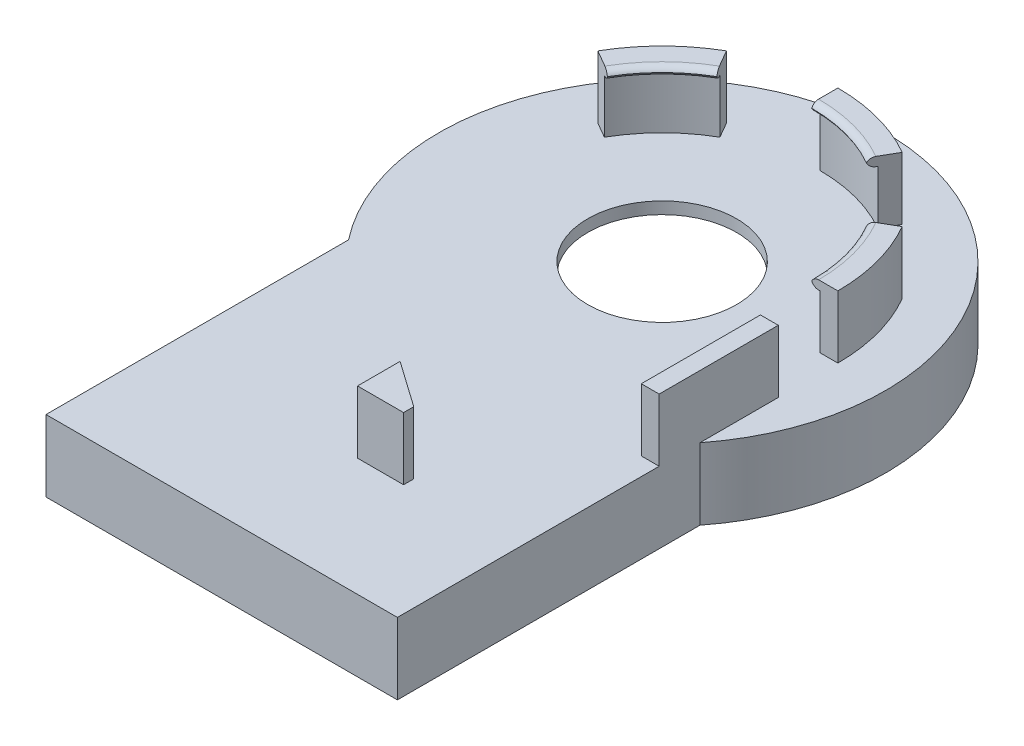
from build123d import *

# Parameters (mm, degrees)
SKETCH1_R           = 37.5
SKETCH1_R_2         = 35.5
BOSS_EXTRUDE1_DEPTH = 10
SKETCH2_R           = 37.5
SKETCH2_R_2         = 12.5
BOSS_EXTRUDE2_DEPTH = 2
BOSS_EXTRUDE3_DEPTH = 9
BOSS_EXTRUDE4_DEPTH = 1.5
FILLET1_R           = 1.27
SKETCH6_W           = 3
SKETCH6_H           = 10.5
BOSS_EXTRUDE5_DEPTH = 30
SKETCH7_W           = 3
SKETCH7_H           = 10
CUT_EXTRUDE1_DEPTH  = 10.5
BOSS_EXTRUDE6_DEPTH = 10.5
BOSS_EXTRUDE8_START = -12
BOSS_EXTRUDE8_DEPTH = 12


with BuildPart() as part:
    # Sketch1 → Boss-Extrude1 (new body)
    with BuildSketch(Plane(origin=(0, 0, 0), x_dir=(1, 0, 0), z_dir=(0, 1, 0))):
        with Locations(Location((0, 0, 0), (0, 0, 270))):
            Circle(SKETCH1_R)
        with Locations(Location((0, 0, 0), (0, 0, 270))):
            Circle(SKETCH1_R_2, mode=Mode.SUBTRACT)
    extrude(amount=BOSS_EXTRUDE1_DEPTH)

    # Sketch2 → Boss-Extrude2 (add)
    with BuildSketch(Plane(origin=(0, 10, 0), x_dir=(1, 0, 0), z_dir=(0, 1, 0))):
        with Locations(Location((0, 0, 0), (0, 0, 270))):
            Circle(SKETCH2_R)
        with Locations(Location((0, 0, 0), (0, 0, 270))):
            Circle(SKETCH2_R_2, mode=Mode.SUBTRACT)
    extrude(amount=BOSS_EXTRUDE2_DEPTH)

    # Sketch4 → Boss-Extrude3 (add)
    with BuildSketch(Plane(origin=(0, 12, 0), x_dir=(1, 0, 0), z_dir=(0, 1, 0))):
        with BuildLine():
            Line((13.25, 22.9496732), (14.75, 25.547749412))
            ThreePointArc((14.75, 25.547749412), (7.635161831, 28.494811876), (0, 29.5))
            Line((0, 29.5), (0, 26.5))
            ThreePointArc((0, 26.5), (6.858704695, 25.597034397), (13.25, 22.9496732))
        make_face()
        with BuildLine():
            ThreePointArc((26.5, 0), (25.597034397, 6.858704695), (22.9496732, 13.25))
            Line((22.9496732, 13.25), (25.547749412, 14.75))
            ThreePointArc((25.547749412, 14.75), (28.494811876, 7.635161831), (29.5, 0))
            Line((29.5, 0), (26.5, 0))
        make_face()
        with BuildLine():
            Line((-13.25, 22.9496732), (-14.75, 25.547749412))
            ThreePointArc((-14.75, 25.547749412), (-20.859650045, 20.859650045), (-25.547749412, 14.75))
            Line((-25.547749412, 14.75), (-22.9496732, 13.25))
            ThreePointArc((-22.9496732, 13.25), (-18.738329701, 18.738329701), (-13.25, 22.9496732))
        make_face()
    extrude(amount=BOSS_EXTRUDE3_DEPTH)

    # Sketch5 → Boss-Extrude4 (add)
    with BuildSketch(Plane(origin=(0, 21, 0), x_dir=(1, 0, 0), z_dir=(0, 1, 0))):
        with BuildLine():
            Line((-12.5, 21.650635095), (-14.75, 25.547749412))
            ThreePointArc((-14.75, 25.547749412), (-20.859650045, 20.859650045), (-25.547749412, 14.75))
            Line((-25.547749412, 14.75), (-21.650635095, 12.5))
            ThreePointArc((-21.650635095, 12.5), (-17.67766953, 17.67766953), (-12.5, 21.650635095))
        make_face()
        with BuildLine():
            ThreePointArc((0, 26.5), (6.858704695, 25.597034397), (13.25, 22.9496732))
            Line((13.25, 22.9496732), (14.75, 25.547749412))
            ThreePointArc((14.75, 25.547749412), (7.635161831, 28.494811876), (0, 29.5))
            Line((0, 29.5), (0, 26.5))
        make_face()
        with BuildLine():
            Line((0, 26.5), (0, 25))
            ThreePointArc((0, 25), (6.470476128, 24.148145657), (12.5, 21.650635095))
            Line((12.5, 21.650635095), (13.25, 22.9496732))
            ThreePointArc((13.25, 22.9496732), (6.858704695, 25.597034397), (0, 26.5))
        make_face()
        with BuildLine():
            Line((25, 0), (29.5, 0))
            ThreePointArc((29.5, 0), (28.494811876, 7.635161831), (25.547749412, 14.75))
            Line((25.547749412, 14.75), (21.650635095, 12.5))
            ThreePointArc((21.650635095, 12.5), (24.148145657, 6.470476128), (25, 0))
        make_face()
    extrude(amount=BOSS_EXTRUDE4_DEPTH)

    # Fillet1
    # the kernel refuses this fillet: 1.27 mm, written as the material it takes off along each edge
    with BuildSketch(Plane(origin=(0, 21, 0), x_dir=(0.795717852622937, 0, -0.605667482218702), z_dir=(-0.605667482218702, 0, -0.795717852622937))) as fillet1_piece_1:
        with BuildLine():
            CenterArc((25 + FILLET1_R, -FILLET1_R), FILLET1_R, 90, 90)
            Line((25 + FILLET1_R, 0), (25, 0))
            Line((25, 0), (25, -FILLET1_R))
        make_face()
    revolve(axis=Axis((0, 21, 0), (0, -1, 0)), revolution_arc=44.553777402, mode=Mode.SUBTRACT)
    with BuildSketch(Plane(origin=(0, 22.5, 0), x_dir=(0.795717852622937, 0, -0.605667482218702), z_dir=(-0.605667482218702, 0, -0.795717852622937))) as fillet1_piece_2:
        with BuildLine():
            CenterArc((25 + FILLET1_R, FILLET1_R), FILLET1_R, 180, 90)
            Line((25, FILLET1_R), (25, 0))
            Line((25, 0), (25 + FILLET1_R, 0))
        make_face()
    revolve(axis=Axis((0, 22.5, 0), (0, -1, 0)), revolution_arc=44.553777402, mode=Mode.SUBTRACT)
    with BuildSketch(Plane(origin=(0, 21, 0), x_dir=(-0.12666449953608933, 0, -0.9919456157256162), z_dir=(-0.9919456157256162, 0, 0.12666449953608933))) as fillet1_piece_3:
        with BuildLine():
            CenterArc((25 + FILLET1_R, -FILLET1_R), FILLET1_R, 90, 90)
            Line((25 + FILLET1_R, 0), (25, 0))
            Line((25, 0), (25, -FILLET1_R))
        make_face()
    revolve(axis=Axis((0, 21, 0), (0, -1, 0)), revolution_arc=44.553777402, mode=Mode.SUBTRACT)
    with BuildSketch(Plane(origin=(0, 22.5, 0), x_dir=(-0.12666449953608933, 0, -0.9919456157256162), z_dir=(-0.9919456157256162, 0, 0.12666449953608933))) as fillet1_piece_4:
        with BuildLine():
            CenterArc((25 + FILLET1_R, FILLET1_R), FILLET1_R, 180, 90)
            Line((25, FILLET1_R), (25, 0))
            Line((25, 0), (25 + FILLET1_R, 0))
        make_face()
    revolve(axis=Axis((0, 22.5, 0), (0, -1, 0)), revolution_arc=44.553777402, mode=Mode.SUBTRACT)
    with BuildSketch(Plane(origin=(0, 21, 0), x_dir=(-0.9223823521590265, 0, -0.386278133506909), z_dir=(-0.386278133506909, 0, 0.9223823521590265))) as fillet1_piece_5:
        with BuildLine():
            CenterArc((25 + FILLET1_R, -FILLET1_R), FILLET1_R, 90, 90)
            Line((25 + FILLET1_R, 0), (25, 0))
            Line((25, 0), (25, -FILLET1_R))
        make_face()
    revolve(axis=Axis((0, 21, 0), (0, -1, 0)), revolution_arc=44.553777402, mode=Mode.SUBTRACT)
    with BuildSketch(Plane(origin=(0, 22.5, 0), x_dir=(-0.9223823521590265, 0, -0.386278133506909), z_dir=(-0.386278133506909, 0, 0.9223823521590265))) as fillet1_piece_6:
        with BuildLine():
            CenterArc((25 + FILLET1_R, FILLET1_R), FILLET1_R, 180, 90)
            Line((25, FILLET1_R), (25, 0))
            Line((25, 0), (25 + FILLET1_R, 0))
        make_face()
    revolve(axis=Axis((0, 22.5, 0), (0, -1, 0)), revolution_arc=44.553777402, mode=Mode.SUBTRACT)

    # Sketch6 → Boss-Extrude5 (add)
    with BuildSketch(Plane.XY):
        with Locations((28, 17.25)):
            Rectangle(SKETCH6_W, SKETCH6_H)
    extrude(amount=BOSS_EXTRUDE5_DEPTH)

    # Sketch7 → Cut-Extrude1 (cut)
    with BuildSketch(Plane(origin=(0, 22.5, 0), x_dir=(1, 0, 0), z_dir=(0, 1, 0))):
        with Locations((28, -5)):
            Rectangle(SKETCH7_W, SKETCH7_H)
    extrude(amount=-CUT_EXTRUDE1_DEPTH, mode=Mode.SUBTRACT)



with BuildPart() as body_2:
    # Sketch8 → Boss-Extrude6 (new body)
    with BuildSketch(Plane(origin=(0, 12, 0), x_dir=(1, 0, 0), z_dir=(0, 1, 0))):
        Polygon((10.733196366, -52.441497251), (3, -47), (3, -54.148297887), (10.733196366, -54.148297887), align=None)
    extrude(amount=BOSS_EXTRUDE6_DEPTH)


with BuildPart() as part_1:
    add(part.part)

    add(body_2.part)  # Boss-Extrude8 merges body 2
    # Sketch9 → Boss-Extrude8 (add)
    with BuildSketch(Plane(origin=(0, 12, 0), x_dir=(1, 0, 0), z_dir=(0, 1, 0)).offset(BOSS_EXTRUDE8_START)):
        with BuildLine():
            Line((-26.911893282, -23.151673806), (-29.5, -23.151673806))
            Line((-29.5, -23.151673806), (-29.5, -73.951673806))
            Line((-29.5, -73.951673806), (29.5, -73.951673806))
            Line((29.5, -73.951673806), (29.5, -23.151673806))
            Line((29.5, -23.151673806), (26.911893282, -23.151673806))
            ThreePointArc((26.911893282, -23.151673806), (0, -35.5), (-26.911893282, -23.151673806))
        make_face()
    extrude(amount=BOSS_EXTRUDE8_DEPTH)


solid = part_1.part
